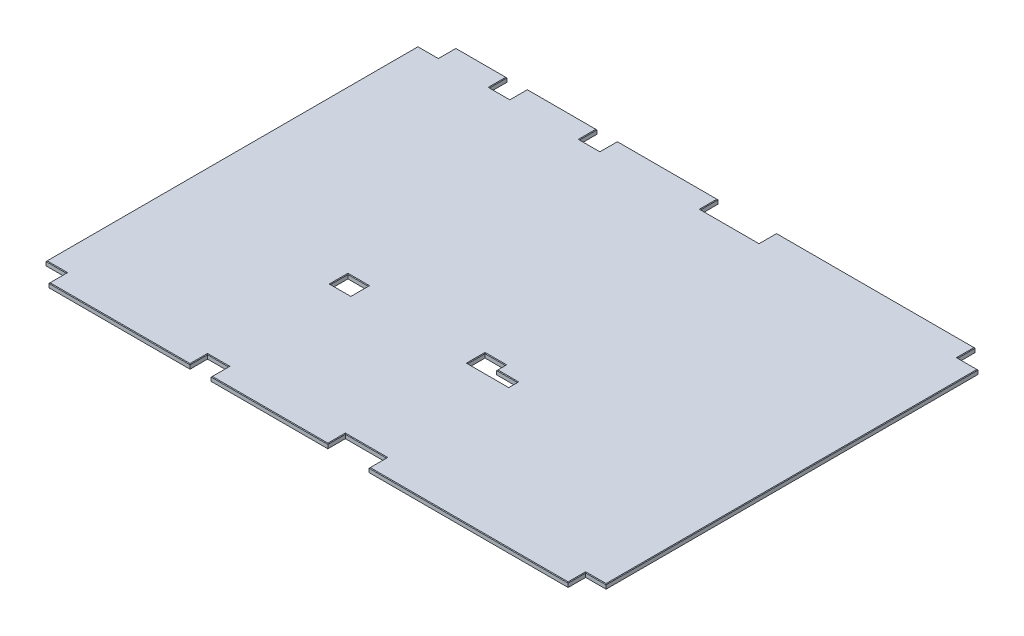
from build123d import *

# Parameters (mm, degrees)
SKETCH1_W                 = 2438.4
SKETCH1_H                 = 1771.65
BOSS_EXTRUDE1_DEPTH       = 9.525
CUT_EXTRUDE2_START        = 1303.3756
CUT_EXTRUDE2_OUTLINE_W    = 19.05
CUT_EXTRUDE2_OUTLINE_H    = 76.2
CUT_EXTRUDE2_OUTLINE_H_2  = 38.1127
CUT_EXTRUDE2_DEPTH        = 179.3875
CUT_EXTRUDE2_START_2      = 706.4756
CUT_EXTRUDE2_2_OUTLINE_W  = 19.05
CUT_EXTRUDE2_2_OUTLINE_H  = 76.2
CUT_EXTRUDE2_2_DEPTH      = 85.725
CUT_EXTRUDE2_3_OUTLINE_W  = 19.05
CUT_EXTRUDE2_3_OUTLINE_H  = 76.2
CUT_EXTRUDE2_3_DEPTH      = 88.9
CUT_EXTRUDE2_START_3      = 2349.5
CUT_EXTRUDE2_4_OUTLINE_W  = 19.05
CUT_EXTRUDE2_4_OUTLINE_H  = 76.2
CUT_EXTRUDE2_4_DEPTH      = 88.9
CUT_EXTRUDE2_START_4      = 311.15
CUT_EXTRUDE2_5_OUTLINE_W  = 19.05
CUT_EXTRUDE2_5_OUTLINE_H  = 76.2
CUT_EXTRUDE2_5_DEPTH      = 88.9
CUT_EXTRUDE2_START_5      = 1230.3252
CUT_EXTRUDE2_6_OUTLINE_W  = 19.05
CUT_EXTRUDE2_6_OUTLINE_H  = 76.2
CUT_EXTRUDE2_6_DEPTH      = 254.7239
CUT_EXTRUDE2_7_OUTLINE_W  = 19.05
CUT_EXTRUDE2_7_OUTLINE_H  = 38.0873
CUT_EXTRUDE2_7_DEPTH      = 88.991565563
CUT_EXTRUDE2_START_6      = 703.2752
CUT_EXTRUDE2_8_OUTLINE_W  = 19.05
CUT_EXTRUDE2_8_OUTLINE_H  = 76.2
CUT_EXTRUDE2_8_DEPTH      = 92.1004
CUT_EXTRUDE2_START_7      = 703.3006
CUT_EXTRUDE2_9_OUTLINE_W  = 19.05
CUT_EXTRUDE2_9_OUTLINE_H  = 76.2
CUT_EXTRUDE2_9_DEPTH      = 3.175
CUT_EXTRUDE2_START_8      = 792.2006
CUT_EXTRUDE2_10_OUTLINE_W = 19.05
CUT_EXTRUDE2_10_OUTLINE_H = 76.2
CUT_EXTRUDE2_10_DEPTH     = 3.175
CHAMFER1_SIZE             = 2.54


# Read off the part's stored shape, not the designer's step: Cut-Extrude2
with BuildPart() as part:
    # Sketch1 → Boss-Extrude1 (new, symmetric)
    with BuildSketch(Plane(origin=(0, 0, 0), x_dir=(1, 0, 0), z_dir=(0, 1, 0))):
        with Locations((1219.2, 885.825)):
            Rectangle(SKETCH1_W, SKETCH1_H)
    extrude(amount=BOSS_EXTRUDE1_DEPTH, both=True)

    # Cut-Extrude2 outline → Cut-Extrude2 (cut)
    with BuildSketch(Plane.YZ.offset(CUT_EXTRUDE2_START)):
        with Locations((0, -1733.55)):
            Rectangle(CUT_EXTRUDE2_OUTLINE_W, CUT_EXTRUDE2_OUTLINE_H)
        with Locations((0, -627.068849999)):
            Rectangle(CUT_EXTRUDE2_OUTLINE_W, CUT_EXTRUDE2_OUTLINE_H_2)
        with Locations((0, -38.1)):
            Rectangle(CUT_EXTRUDE2_OUTLINE_W, CUT_EXTRUDE2_OUTLINE_H)
    extrude(amount=CUT_EXTRUDE2_DEPTH, mode=Mode.SUBTRACT)

    # Cut-Extrude2 2 outline → Cut-Extrude2 2 (cut)
    with BuildSketch(Plane.YZ.offset(CUT_EXTRUDE2_START_2)):
        with Locations((0, -1733.55)):
            Rectangle(CUT_EXTRUDE2_2_OUTLINE_W, CUT_EXTRUDE2_2_OUTLINE_H)
        with Locations((0, -646.112499999)):
            Rectangle(CUT_EXTRUDE2_2_OUTLINE_W, CUT_EXTRUDE2_2_OUTLINE_H)
        with Locations((0, -38.1)):
            Rectangle(CUT_EXTRUDE2_2_OUTLINE_W, CUT_EXTRUDE2_2_OUTLINE_H)
    extrude(amount=CUT_EXTRUDE2_2_DEPTH, mode=Mode.SUBTRACT)

    # Cut-Extrude2 3 outline → Cut-Extrude2 3 (cut)
    with BuildSketch(Plane.YZ):
        with Locations((0, -1733.55)):
            Rectangle(CUT_EXTRUDE2_3_OUTLINE_W, CUT_EXTRUDE2_3_OUTLINE_H)
        with Locations((0, -38.1)):
            Rectangle(CUT_EXTRUDE2_3_OUTLINE_W, CUT_EXTRUDE2_3_OUTLINE_H)
    extrude(amount=CUT_EXTRUDE2_3_DEPTH, mode=Mode.SUBTRACT)

    # Cut-Extrude2 4 outline → Cut-Extrude2 4 (cut)
    with BuildSketch(Plane.YZ.offset(CUT_EXTRUDE2_START_3)):
        with Locations((0, -1733.55)):
            Rectangle(CUT_EXTRUDE2_4_OUTLINE_W, CUT_EXTRUDE2_4_OUTLINE_H)
        with Locations((0, -38.1)):
            Rectangle(CUT_EXTRUDE2_4_OUTLINE_W, CUT_EXTRUDE2_4_OUTLINE_H)
    extrude(amount=CUT_EXTRUDE2_4_DEPTH, mode=Mode.SUBTRACT)

    # Cut-Extrude2 5 outline → Cut-Extrude2 5 (cut)
    with BuildSketch(Plane.YZ.offset(CUT_EXTRUDE2_START_4)):
        with Locations((0, -1733.55)):
            Rectangle(CUT_EXTRUDE2_5_OUTLINE_W, CUT_EXTRUDE2_5_OUTLINE_H)
    extrude(amount=CUT_EXTRUDE2_5_DEPTH, mode=Mode.SUBTRACT)

    # Cut-Extrude2 6 outline → Cut-Extrude2 6 (cut)
    with BuildSketch(Plane.YZ.offset(CUT_EXTRUDE2_START_5)):
        with Locations((0, -1733.55)):
            Rectangle(CUT_EXTRUDE2_6_OUTLINE_W, CUT_EXTRUDE2_6_OUTLINE_H)
    extrude(amount=CUT_EXTRUDE2_6_DEPTH, mode=Mode.SUBTRACT)

    # Cut-Extrude2 7 outline → Cut-Extrude2 7 (cut)
    with BuildSketch(Plane.YZ.offset(CUT_EXTRUDE2_START)):
        with Locations((0, -665.168849999)):
            Rectangle(CUT_EXTRUDE2_7_OUTLINE_W, CUT_EXTRUDE2_7_OUTLINE_H)
    extrude(amount=CUT_EXTRUDE2_7_DEPTH, mode=Mode.SUBTRACT)

    # Cut-Extrude2 8 outline → Cut-Extrude2 8 (cut)
    with BuildSketch(Plane.YZ.offset(CUT_EXTRUDE2_START_6)):
        with Locations((0, -38.1)):
            Rectangle(CUT_EXTRUDE2_8_OUTLINE_W, CUT_EXTRUDE2_8_OUTLINE_H)
    extrude(amount=CUT_EXTRUDE2_8_DEPTH, mode=Mode.SUBTRACT)

    # Cut-Extrude2 9 outline → Cut-Extrude2 9 (cut)
    with BuildSketch(Plane.YZ.offset(CUT_EXTRUDE2_START_7)):
        with Locations((0, -1733.55)):
            Rectangle(CUT_EXTRUDE2_9_OUTLINE_W, CUT_EXTRUDE2_9_OUTLINE_H)
    extrude(amount=CUT_EXTRUDE2_9_DEPTH, mode=Mode.SUBTRACT)

    # Cut-Extrude2 10 outline → Cut-Extrude2 10 (cut)
    with BuildSketch(Plane.YZ.offset(CUT_EXTRUDE2_START_8)):
        with Locations((0, -646.112499999)):
            Rectangle(CUT_EXTRUDE2_10_OUTLINE_W, CUT_EXTRUDE2_10_OUTLINE_H)
    extrude(amount=CUT_EXTRUDE2_10_DEPTH, mode=Mode.SUBTRACT)

    # Chamfer1
    chamfer1_edges = [part.edges().sort_by_distance(p)[0] for p in [
        (1303.3756, 9.525, -646.112499999),
        (1393.06935, 9.525, -608.012499999),
        (1482.7631, 9.525, -627.068849999),
        (1437.565132782, 9.525, -646.125199999),
        (1392.367165563, 9.525, -665.168849999),
        (1347.871382781, 9.525, -684.212499999),
        (88.9, 9.525, -38.1),
        (44.45, 9.525, -76.2),
        (795.3756, 9.525, -38.1),
        (749.3254, 9.525, -76.2),
        (703.2752, 9.525, -38.1),
        (1482.7631, 9.525, -38.1),
        (1393.06935, 9.525, -76.2),
        (1303.3756, 9.525, -38.1),
        (2393.95, 9.525, -76.2),
        (2349.5, 9.525, -38.1),
        (44.45, 9.525, -1695.45),
        (88.9, 9.525, -1733.55),
        (0, 9.525, -885.825),
        (396.0876, 9.525, 0),
        (1049.3756, 9.525, 0),
        (1916.13155, 9.525, 0),
        (2438.4, 9.525, -885.825),
        (1917.27455, 9.525, -1771.65),
        (1011.2629, 9.525, -1771.65),
        (551.6753, 9.525, -1771.65),
        (200.025, 9.525, -1771.65),
        (311.15, 9.525, -1733.55),
        (355.6, 9.525, -1695.45),
        (400.05, 9.525, -1733.55),
        (703.3006, 9.525, -1733.55),
        (747.7506, 9.525, -1695.45),
        (792.2006, 9.525, -1733.55),
        (1230.3252, 9.525, -1733.55),
        (1357.68715, 9.525, -1695.45),
        (1485.0491, 9.525, -1733.55),
        (2349.5, 9.525, -1733.55),
        (2393.95, 9.525, -1695.45),
        (706.4756, 9.525, -646.112499999),
        (750.9256, 9.525, -608.012499999),
        (795.3756, 9.525, -646.112499999),
        (750.9256, 9.525, -684.212499999),
    ]]
    chamfer(chamfer1_edges, length=CHAMFER1_SIZE)


solid = part.part
